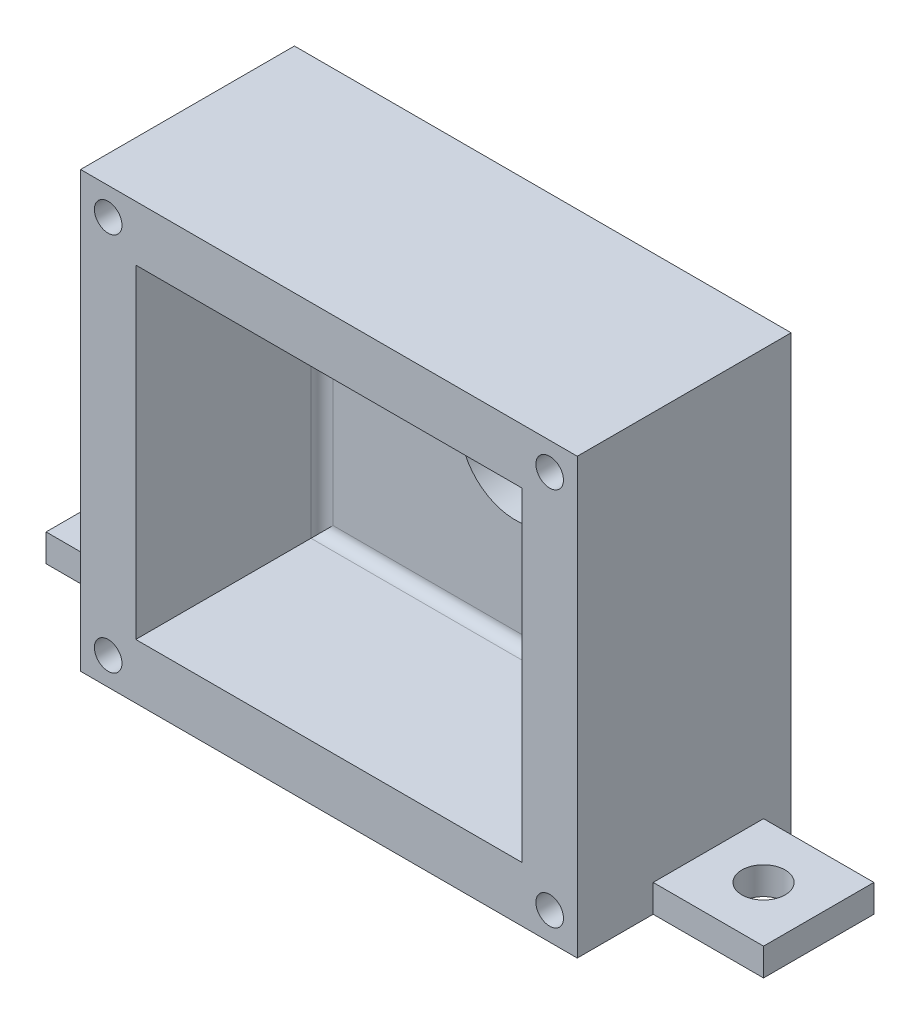
from build123d import *

# Parameters (mm, degrees)
SKETCH1_W           = 57.15
SKETCH1_H           = 50.00625
SKETCH1_W_2         = 44.45
SKETCH1_H_2         = 37.30625
BOSS_EXTRUDE1_DEPTH = 21.43125
SKETCH2_W           = 57.15
SKETCH2_H           = 50.00625
SKETCH2_R           = 6.35
BOSS_EXTRUDE2_DEPTH = 3.175
SKETCH4_W           = 12.7
SKETCH4_H           = 3.175
BOSS_EXTRUDE3_DEPTH = 12.7
SKETCH5_R           = 2.4892
CUT_EXTRUDE1_DEPTH  = 3.175
FILLET1_R           = 1.27
SKETCH6_R           = 1.5875
CUT_EXTRUDE2_DEPTH  = 9.525


with BuildPart() as part:
    # Sketch1 → Boss-Extrude1 (new body)
    with BuildSketch(Plane.XY):
        Rectangle(SKETCH1_W, SKETCH1_H)
        Rectangle(SKETCH1_W_2, SKETCH1_H_2, mode=Mode.SUBTRACT)
    extrude(amount=BOSS_EXTRUDE1_DEPTH)

    # Sketch2 → Boss-Extrude2 (add)
    with BuildSketch(Plane.XY):
        Rectangle(SKETCH2_W, SKETCH2_H)
        Circle(SKETCH2_R, mode=Mode.SUBTRACT)
    extrude(amount=-BOSS_EXTRUDE2_DEPTH)

    # Sketch4 → Boss-Extrude3 (add)
    with BuildSketch(Plane.XY):
        with Locations((-34.925, -23.415625)):
            Rectangle(SKETCH4_W, SKETCH4_H)
        with Locations((34.925, -23.415625)):
            Rectangle(SKETCH4_W, SKETCH4_H)
    extrude(amount=BOSS_EXTRUDE3_DEPTH)

    # Sketch5 → Cut-Extrude1 (cut)
    with BuildSketch(Plane(origin=(0, -21.828125, 0), x_dir=(1, 0, 0), z_dir=(0, 1, 0))):
        with Locations((-34.925, -6.35)):
            Circle(SKETCH5_R)
        with Locations((34.925, -6.35)):
            Circle(SKETCH5_R)
    extrude(amount=-CUT_EXTRUDE1_DEPTH, mode=Mode.SUBTRACT)

    # Fillet1
    fillet1_edges = [part.edges().sort_by_distance(p)[0] for p in [
        (0, -18.653125, 0),
        (22.225, 0, 0),
        (0, 18.653125, 0),
        (-22.225, 0, 0),
    ]]
    fillet(fillet1_edges, radius=FILLET1_R)

    # Sketch6 → Cut-Extrude2 (cut)
    with BuildSketch(Plane.XY.offset(21.43125)):
        with Locations((-25.4, 21.828125)):
            Circle(SKETCH6_R)
        with Locations((25.4, 21.828125)):
            Circle(SKETCH6_R)
        with Locations((25.4, -21.828125)):
            Circle(SKETCH6_R)
        with Locations((-25.4, -21.828125)):
            Circle(SKETCH6_R)
    extrude(amount=-CUT_EXTRUDE2_DEPTH, mode=Mode.SUBTRACT)


solid = part.part
